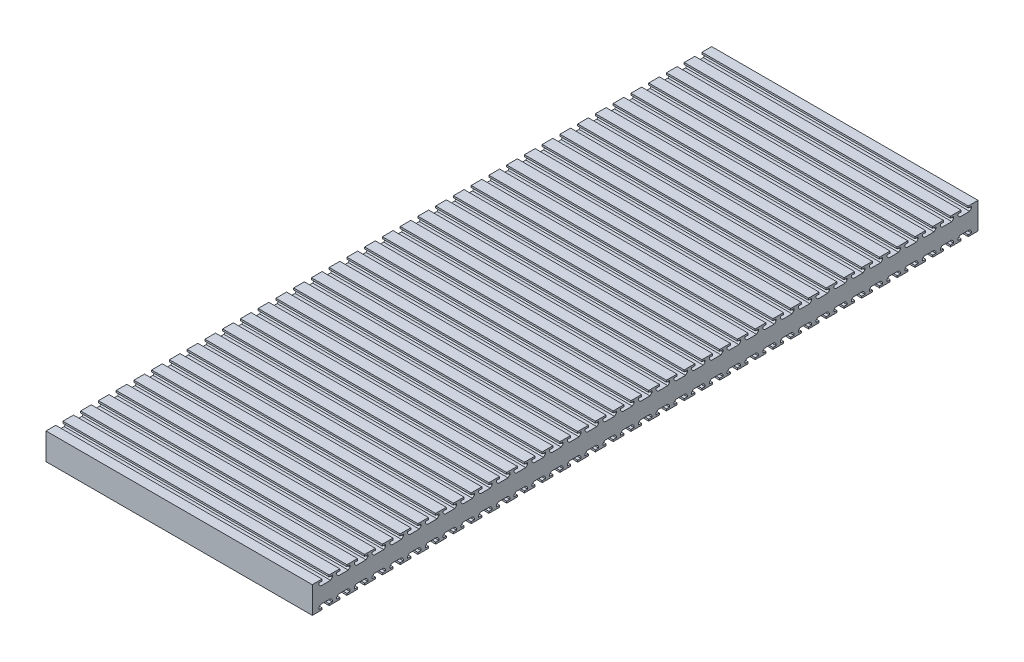
from build123d import *

# Parameters (mm, degrees)
ESBO_O1_W                = 300
ESBO_O1_H                = 30
RESSALTO_EXTRUS_O1_DEPTH = 375
CORTE_EXTRUS_O1_DEPTH    = 481.468521341
PADR_O_LINEAR1_COUNT     = 37
PADR_O_LINEAR1_PITCH     = 20
ESPELHAR1_COPY_1_DEPTH   = 481.468521341
ESPELHAR1_COPY_2_DEPTH   = 481.468521341
ESPELHAR1_COPY_3_DEPTH   = 481.468521341
ESPELHAR1_COPY_4_DEPTH   = 481.468521341
ESPELHAR1_COPY_5_DEPTH   = 481.468521341
ESPELHAR1_COPY_6_DEPTH   = 481.468521341
ESPELHAR1_COPY_7_DEPTH   = 481.468521341
ESPELHAR1_COPY_8_DEPTH   = 481.468521341
ESPELHAR1_COPY_9_DEPTH   = 481.468521341
ESPELHAR1_COPY_10_DEPTH  = 481.468521341
ESPELHAR1_COPY_11_DEPTH  = 481.468521341
ESPELHAR1_COPY_12_DEPTH  = 481.468521341
ESPELHAR1_COPY_13_DEPTH  = 481.468521341
ESPELHAR1_COPY_14_DEPTH  = 481.468521341
ESPELHAR1_COPY_15_DEPTH  = 481.468521341
ESPELHAR1_COPY_16_DEPTH  = 481.468521341
ESPELHAR1_COPY_17_DEPTH  = 481.468521341
ESPELHAR1_COPY_18_DEPTH  = 481.468521341
ESPELHAR1_COPY_19_DEPTH  = 481.468521341
ESPELHAR1_COPY_20_DEPTH  = 481.468521341
ESPELHAR1_COPY_21_DEPTH  = 481.468521341
ESPELHAR1_COPY_22_DEPTH  = 481.468521341
ESPELHAR1_COPY_23_DEPTH  = 481.468521341
ESPELHAR1_COPY_24_DEPTH  = 481.468521341
ESPELHAR1_COPY_25_DEPTH  = 481.468521341
ESPELHAR1_COPY_26_DEPTH  = 481.468521341
ESPELHAR1_COPY_27_DEPTH  = 481.468521341
ESPELHAR1_COPY_28_DEPTH  = 481.468521341
ESPELHAR1_COPY_29_DEPTH  = 481.468521341
ESPELHAR1_COPY_30_DEPTH  = 481.468521341
ESPELHAR1_COPY_31_DEPTH  = 481.468521341
ESPELHAR1_COPY_32_DEPTH  = 481.468521341
ESPELHAR1_COPY_33_DEPTH  = 481.468521341
ESPELHAR1_COPY_34_DEPTH  = 481.468521341
ESPELHAR1_COPY_35_DEPTH  = 481.468521341
ESPELHAR1_COPY_36_DEPTH  = 481.468521341
ESPELHAR1_COPY_37_DEPTH  = 481.468521341


with BuildPart() as part:
    # Esboço1 → Ressalto-extrusão1 (new, symmetric)
    with BuildSketch(Plane.XY):
        Rectangle(ESBO_O1_W, ESBO_O1_H)
    extrude(amount=RESSALTO_EXTRUS_O1_DEPTH, both=True)

    # Esboço2 → Corte-extrusão1 (cut, through all)
    with BuildSketch(Plane(origin=(150, 0, 0), x_dir=(0, 0, -1), z_dir=(1, 0, 0))):
        Polygon((-364, 15), (-364, 13), (-367.5, 13), (-367.5, 11), (-365.5, 9), (-354.5, 9), (-352.5, 11), (-352.5, 13), (-356, 13), (-356, 15), align=None)
    corte_extrus_o1 = extrude(amount=-CORTE_EXTRUS_O1_DEPTH, mode=Mode.SUBTRACT)

    # Padrão linear1: Corte-extrusão1 ×37
    with Locations(*[(0, 0, -i * PADR_O_LINEAR1_PITCH) for i in range(1, PADR_O_LINEAR1_COUNT)]):
        add(corte_extrus_o1, mode=Mode.SUBTRACT)

    # Espelhar1 copy 1 sketch → Espelhar1 copy 1 (cut, through all)
    with BuildSketch(Plane(origin=(150, 0, -20), x_dir=(0, 0, -1), z_dir=(1, 0, 0))):
        Polygon((-364, -15), (-364, -13), (-367.5, -13), (-367.5, -11), (-365.5, -9), (-354.5, -9), (-352.5, -11), (-352.5, -13), (-356, -13), (-356, -15), align=None)
    extrude(amount=-ESPELHAR1_COPY_1_DEPTH, mode=Mode.SUBTRACT)

    # Espelhar1 copy 2 sketch → Espelhar1 copy 2 (cut, through all)
    with BuildSketch(Plane(origin=(150, 0, -40), x_dir=(0, 0, -1), z_dir=(1, 0, 0))):
        Polygon((-364, -15), (-364, -13), (-367.5, -13), (-367.5, -11), (-365.5, -9), (-354.5, -9), (-352.5, -11), (-352.5, -13), (-356, -13), (-356, -15), align=None)
    extrude(amount=-ESPELHAR1_COPY_2_DEPTH, mode=Mode.SUBTRACT)

    # Espelhar1 copy 3 sketch → Espelhar1 copy 3 (cut, through all)
    with BuildSketch(Plane(origin=(150, 0, -60), x_dir=(0, 0, -1), z_dir=(1, 0, 0))):
        Polygon((-364, -15), (-364, -13), (-367.5, -13), (-367.5, -11), (-365.5, -9), (-354.5, -9), (-352.5, -11), (-352.5, -13), (-356, -13), (-356, -15), align=None)
    extrude(amount=-ESPELHAR1_COPY_3_DEPTH, mode=Mode.SUBTRACT)

    # Espelhar1 copy 4 sketch → Espelhar1 copy 4 (cut, through all)
    with BuildSketch(Plane(origin=(150, 0, -80), x_dir=(0, 0, -1), z_dir=(1, 0, 0))):
        Polygon((-364, -15), (-364, -13), (-367.5, -13), (-367.5, -11), (-365.5, -9), (-354.5, -9), (-352.5, -11), (-352.5, -13), (-356, -13), (-356, -15), align=None)
    extrude(amount=-ESPELHAR1_COPY_4_DEPTH, mode=Mode.SUBTRACT)

    # Espelhar1 copy 5 sketch → Espelhar1 copy 5 (cut, through all)
    with BuildSketch(Plane(origin=(150, 0, -100), x_dir=(0, 0, -1), z_dir=(1, 0, 0))):
        Polygon((-364, -15), (-364, -13), (-367.5, -13), (-367.5, -11), (-365.5, -9), (-354.5, -9), (-352.5, -11), (-352.5, -13), (-356, -13), (-356, -15), align=None)
    extrude(amount=-ESPELHAR1_COPY_5_DEPTH, mode=Mode.SUBTRACT)

    # Espelhar1 copy 6 sketch → Espelhar1 copy 6 (cut, through all)
    with BuildSketch(Plane(origin=(150, 0, -120), x_dir=(0, 0, -1), z_dir=(1, 0, 0))):
        Polygon((-364, -15), (-364, -13), (-367.5, -13), (-367.5, -11), (-365.5, -9), (-354.5, -9), (-352.5, -11), (-352.5, -13), (-356, -13), (-356, -15), align=None)
    extrude(amount=-ESPELHAR1_COPY_6_DEPTH, mode=Mode.SUBTRACT)

    # Espelhar1 copy 7 sketch → Espelhar1 copy 7 (cut, through all)
    with BuildSketch(Plane(origin=(150, 0, -140), x_dir=(0, 0, -1), z_dir=(1, 0, 0))):
        Polygon((-364, -15), (-364, -13), (-367.5, -13), (-367.5, -11), (-365.5, -9), (-354.5, -9), (-352.5, -11), (-352.5, -13), (-356, -13), (-356, -15), align=None)
    extrude(amount=-ESPELHAR1_COPY_7_DEPTH, mode=Mode.SUBTRACT)

    # Espelhar1 copy 8 sketch → Espelhar1 copy 8 (cut, through all)
    with BuildSketch(Plane(origin=(150, 0, -160), x_dir=(0, 0, -1), z_dir=(1, 0, 0))):
        Polygon((-364, -15), (-364, -13), (-367.5, -13), (-367.5, -11), (-365.5, -9), (-354.5, -9), (-352.5, -11), (-352.5, -13), (-356, -13), (-356, -15), align=None)
    extrude(amount=-ESPELHAR1_COPY_8_DEPTH, mode=Mode.SUBTRACT)

    # Espelhar1 copy 9 sketch → Espelhar1 copy 9 (cut, through all)
    with BuildSketch(Plane(origin=(150, 0, -180), x_dir=(0, 0, -1), z_dir=(1, 0, 0))):
        Polygon((-364, -15), (-364, -13), (-367.5, -13), (-367.5, -11), (-365.5, -9), (-354.5, -9), (-352.5, -11), (-352.5, -13), (-356, -13), (-356, -15), align=None)
    extrude(amount=-ESPELHAR1_COPY_9_DEPTH, mode=Mode.SUBTRACT)

    # Espelhar1 copy 10 sketch → Espelhar1 copy 10 (cut, through all)
    with BuildSketch(Plane(origin=(150, 0, -200), x_dir=(0, 0, -1), z_dir=(1, 0, 0))):
        Polygon((-364, -15), (-364, -13), (-367.5, -13), (-367.5, -11), (-365.5, -9), (-354.5, -9), (-352.5, -11), (-352.5, -13), (-356, -13), (-356, -15), align=None)
    extrude(amount=-ESPELHAR1_COPY_10_DEPTH, mode=Mode.SUBTRACT)

    # Espelhar1 copy 11 sketch → Espelhar1 copy 11 (cut, through all)
    with BuildSketch(Plane(origin=(150, 0, -220), x_dir=(0, 0, -1), z_dir=(1, 0, 0))):
        Polygon((-364, -15), (-364, -13), (-367.5, -13), (-367.5, -11), (-365.5, -9), (-354.5, -9), (-352.5, -11), (-352.5, -13), (-356, -13), (-356, -15), align=None)
    extrude(amount=-ESPELHAR1_COPY_11_DEPTH, mode=Mode.SUBTRACT)

    # Espelhar1 copy 12 sketch → Espelhar1 copy 12 (cut, through all)
    with BuildSketch(Plane(origin=(150, 0, -240), x_dir=(0, 0, -1), z_dir=(1, 0, 0))):
        Polygon((-364, -15), (-364, -13), (-367.5, -13), (-367.5, -11), (-365.5, -9), (-354.5, -9), (-352.5, -11), (-352.5, -13), (-356, -13), (-356, -15), align=None)
    extrude(amount=-ESPELHAR1_COPY_12_DEPTH, mode=Mode.SUBTRACT)

    # Espelhar1 copy 13 sketch → Espelhar1 copy 13 (cut, through all)
    with BuildSketch(Plane(origin=(150, 0, -260), x_dir=(0, 0, -1), z_dir=(1, 0, 0))):
        Polygon((-364, -15), (-364, -13), (-367.5, -13), (-367.5, -11), (-365.5, -9), (-354.5, -9), (-352.5, -11), (-352.5, -13), (-356, -13), (-356, -15), align=None)
    extrude(amount=-ESPELHAR1_COPY_13_DEPTH, mode=Mode.SUBTRACT)

    # Espelhar1 copy 14 sketch → Espelhar1 copy 14 (cut, through all)
    with BuildSketch(Plane(origin=(150, 0, -280), x_dir=(0, 0, -1), z_dir=(1, 0, 0))):
        Polygon((-364, -15), (-364, -13), (-367.5, -13), (-367.5, -11), (-365.5, -9), (-354.5, -9), (-352.5, -11), (-352.5, -13), (-356, -13), (-356, -15), align=None)
    extrude(amount=-ESPELHAR1_COPY_14_DEPTH, mode=Mode.SUBTRACT)

    # Espelhar1 copy 15 sketch → Espelhar1 copy 15 (cut, through all)
    with BuildSketch(Plane(origin=(150, 0, -300), x_dir=(0, 0, -1), z_dir=(1, 0, 0))):
        Polygon((-364, -15), (-364, -13), (-367.5, -13), (-367.5, -11), (-365.5, -9), (-354.5, -9), (-352.5, -11), (-352.5, -13), (-356, -13), (-356, -15), align=None)
    extrude(amount=-ESPELHAR1_COPY_15_DEPTH, mode=Mode.SUBTRACT)

    # Espelhar1 copy 16 sketch → Espelhar1 copy 16 (cut, through all)
    with BuildSketch(Plane(origin=(150, 0, -320), x_dir=(0, 0, -1), z_dir=(1, 0, 0))):
        Polygon((-364, -15), (-364, -13), (-367.5, -13), (-367.5, -11), (-365.5, -9), (-354.5, -9), (-352.5, -11), (-352.5, -13), (-356, -13), (-356, -15), align=None)
    extrude(amount=-ESPELHAR1_COPY_16_DEPTH, mode=Mode.SUBTRACT)

    # Espelhar1 copy 17 sketch → Espelhar1 copy 17 (cut, through all)
    with BuildSketch(Plane(origin=(150, 0, -340), x_dir=(0, 0, -1), z_dir=(1, 0, 0))):
        Polygon((-364, -15), (-364, -13), (-367.5, -13), (-367.5, -11), (-365.5, -9), (-354.5, -9), (-352.5, -11), (-352.5, -13), (-356, -13), (-356, -15), align=None)
    extrude(amount=-ESPELHAR1_COPY_17_DEPTH, mode=Mode.SUBTRACT)

    # Espelhar1 copy 18 sketch → Espelhar1 copy 18 (cut, through all)
    with BuildSketch(Plane(origin=(150, 0, -360), x_dir=(0, 0, -1), z_dir=(1, 0, 0))):
        Polygon((-364, -15), (-364, -13), (-367.5, -13), (-367.5, -11), (-365.5, -9), (-354.5, -9), (-352.5, -11), (-352.5, -13), (-356, -13), (-356, -15), align=None)
    extrude(amount=-ESPELHAR1_COPY_18_DEPTH, mode=Mode.SUBTRACT)

    # Espelhar1 copy 19 sketch → Espelhar1 copy 19 (cut, through all)
    with BuildSketch(Plane(origin=(150, 0, -380), x_dir=(0, 0, -1), z_dir=(1, 0, 0))):
        Polygon((-364, -15), (-364, -13), (-367.5, -13), (-367.5, -11), (-365.5, -9), (-354.5, -9), (-352.5, -11), (-352.5, -13), (-356, -13), (-356, -15), align=None)
    extrude(amount=-ESPELHAR1_COPY_19_DEPTH, mode=Mode.SUBTRACT)

    # Espelhar1 copy 20 sketch → Espelhar1 copy 20 (cut, through all)
    with BuildSketch(Plane(origin=(150, 0, -400), x_dir=(0, 0, -1), z_dir=(1, 0, 0))):
        Polygon((-364, -15), (-364, -13), (-367.5, -13), (-367.5, -11), (-365.5, -9), (-354.5, -9), (-352.5, -11), (-352.5, -13), (-356, -13), (-356, -15), align=None)
    extrude(amount=-ESPELHAR1_COPY_20_DEPTH, mode=Mode.SUBTRACT)

    # Espelhar1 copy 21 sketch → Espelhar1 copy 21 (cut, through all)
    with BuildSketch(Plane(origin=(150, 0, -420), x_dir=(0, 0, -1), z_dir=(1, 0, 0))):
        Polygon((-364, -15), (-364, -13), (-367.5, -13), (-367.5, -11), (-365.5, -9), (-354.5, -9), (-352.5, -11), (-352.5, -13), (-356, -13), (-356, -15), align=None)
    extrude(amount=-ESPELHAR1_COPY_21_DEPTH, mode=Mode.SUBTRACT)

    # Espelhar1 copy 22 sketch → Espelhar1 copy 22 (cut, through all)
    with BuildSketch(Plane(origin=(150, 0, -440), x_dir=(0, 0, -1), z_dir=(1, 0, 0))):
        Polygon((-364, -15), (-364, -13), (-367.5, -13), (-367.5, -11), (-365.5, -9), (-354.5, -9), (-352.5, -11), (-352.5, -13), (-356, -13), (-356, -15), align=None)
    extrude(amount=-ESPELHAR1_COPY_22_DEPTH, mode=Mode.SUBTRACT)

    # Espelhar1 copy 23 sketch → Espelhar1 copy 23 (cut, through all)
    with BuildSketch(Plane(origin=(150, 0, -460), x_dir=(0, 0, -1), z_dir=(1, 0, 0))):
        Polygon((-364, -15), (-364, -13), (-367.5, -13), (-367.5, -11), (-365.5, -9), (-354.5, -9), (-352.5, -11), (-352.5, -13), (-356, -13), (-356, -15), align=None)
    extrude(amount=-ESPELHAR1_COPY_23_DEPTH, mode=Mode.SUBTRACT)

    # Espelhar1 copy 24 sketch → Espelhar1 copy 24 (cut, through all)
    with BuildSketch(Plane(origin=(150, 0, -480), x_dir=(0, 0, -1), z_dir=(1, 0, 0))):
        Polygon((-364, -15), (-364, -13), (-367.5, -13), (-367.5, -11), (-365.5, -9), (-354.5, -9), (-352.5, -11), (-352.5, -13), (-356, -13), (-356, -15), align=None)
    extrude(amount=-ESPELHAR1_COPY_24_DEPTH, mode=Mode.SUBTRACT)

    # Espelhar1 copy 25 sketch → Espelhar1 copy 25 (cut, through all)
    with BuildSketch(Plane(origin=(150, 0, -500), x_dir=(0, 0, -1), z_dir=(1, 0, 0))):
        Polygon((-364, -15), (-364, -13), (-367.5, -13), (-367.5, -11), (-365.5, -9), (-354.5, -9), (-352.5, -11), (-352.5, -13), (-356, -13), (-356, -15), align=None)
    extrude(amount=-ESPELHAR1_COPY_25_DEPTH, mode=Mode.SUBTRACT)

    # Espelhar1 copy 26 sketch → Espelhar1 copy 26 (cut, through all)
    with BuildSketch(Plane(origin=(150, 0, -520), x_dir=(0, 0, -1), z_dir=(1, 0, 0))):
        Polygon((-364, -15), (-364, -13), (-367.5, -13), (-367.5, -11), (-365.5, -9), (-354.5, -9), (-352.5, -11), (-352.5, -13), (-356, -13), (-356, -15), align=None)
    extrude(amount=-ESPELHAR1_COPY_26_DEPTH, mode=Mode.SUBTRACT)

    # Espelhar1 copy 27 sketch → Espelhar1 copy 27 (cut, through all)
    with BuildSketch(Plane(origin=(150, 0, -540), x_dir=(0, 0, -1), z_dir=(1, 0, 0))):
        Polygon((-364, -15), (-364, -13), (-367.5, -13), (-367.5, -11), (-365.5, -9), (-354.5, -9), (-352.5, -11), (-352.5, -13), (-356, -13), (-356, -15), align=None)
    extrude(amount=-ESPELHAR1_COPY_27_DEPTH, mode=Mode.SUBTRACT)

    # Espelhar1 copy 28 sketch → Espelhar1 copy 28 (cut, through all)
    with BuildSketch(Plane(origin=(150, 0, -560), x_dir=(0, 0, -1), z_dir=(1, 0, 0))):
        Polygon((-364, -15), (-364, -13), (-367.5, -13), (-367.5, -11), (-365.5, -9), (-354.5, -9), (-352.5, -11), (-352.5, -13), (-356, -13), (-356, -15), align=None)
    extrude(amount=-ESPELHAR1_COPY_28_DEPTH, mode=Mode.SUBTRACT)

    # Espelhar1 copy 29 sketch → Espelhar1 copy 29 (cut, through all)
    with BuildSketch(Plane(origin=(150, 0, -580), x_dir=(0, 0, -1), z_dir=(1, 0, 0))):
        Polygon((-364, -15), (-364, -13), (-367.5, -13), (-367.5, -11), (-365.5, -9), (-354.5, -9), (-352.5, -11), (-352.5, -13), (-356, -13), (-356, -15), align=None)
    extrude(amount=-ESPELHAR1_COPY_29_DEPTH, mode=Mode.SUBTRACT)

    # Espelhar1 copy 30 sketch → Espelhar1 copy 30 (cut, through all)
    with BuildSketch(Plane(origin=(150, 0, -600), x_dir=(0, 0, -1), z_dir=(1, 0, 0))):
        Polygon((-364, -15), (-364, -13), (-367.5, -13), (-367.5, -11), (-365.5, -9), (-354.5, -9), (-352.5, -11), (-352.5, -13), (-356, -13), (-356, -15), align=None)
    extrude(amount=-ESPELHAR1_COPY_30_DEPTH, mode=Mode.SUBTRACT)

    # Espelhar1 copy 31 sketch → Espelhar1 copy 31 (cut, through all)
    with BuildSketch(Plane(origin=(150, 0, -620), x_dir=(0, 0, -1), z_dir=(1, 0, 0))):
        Polygon((-364, -15), (-364, -13), (-367.5, -13), (-367.5, -11), (-365.5, -9), (-354.5, -9), (-352.5, -11), (-352.5, -13), (-356, -13), (-356, -15), align=None)
    extrude(amount=-ESPELHAR1_COPY_31_DEPTH, mode=Mode.SUBTRACT)

    # Espelhar1 copy 32 sketch → Espelhar1 copy 32 (cut, through all)
    with BuildSketch(Plane(origin=(150, 0, -640), x_dir=(0, 0, -1), z_dir=(1, 0, 0))):
        Polygon((-364, -15), (-364, -13), (-367.5, -13), (-367.5, -11), (-365.5, -9), (-354.5, -9), (-352.5, -11), (-352.5, -13), (-356, -13), (-356, -15), align=None)
    extrude(amount=-ESPELHAR1_COPY_32_DEPTH, mode=Mode.SUBTRACT)

    # Espelhar1 copy 33 sketch → Espelhar1 copy 33 (cut, through all)
    with BuildSketch(Plane(origin=(150, 0, -660), x_dir=(0, 0, -1), z_dir=(1, 0, 0))):
        Polygon((-364, -15), (-364, -13), (-367.5, -13), (-367.5, -11), (-365.5, -9), (-354.5, -9), (-352.5, -11), (-352.5, -13), (-356, -13), (-356, -15), align=None)
    extrude(amount=-ESPELHAR1_COPY_33_DEPTH, mode=Mode.SUBTRACT)

    # Espelhar1 copy 34 sketch → Espelhar1 copy 34 (cut, through all)
    with BuildSketch(Plane(origin=(150, 0, -680), x_dir=(0, 0, -1), z_dir=(1, 0, 0))):
        Polygon((-364, -15), (-364, -13), (-367.5, -13), (-367.5, -11), (-365.5, -9), (-354.5, -9), (-352.5, -11), (-352.5, -13), (-356, -13), (-356, -15), align=None)
    extrude(amount=-ESPELHAR1_COPY_34_DEPTH, mode=Mode.SUBTRACT)

    # Espelhar1 copy 35 sketch → Espelhar1 copy 35 (cut, through all)
    with BuildSketch(Plane(origin=(150, 0, -700), x_dir=(0, 0, -1), z_dir=(1, 0, 0))):
        Polygon((-364, -15), (-364, -13), (-367.5, -13), (-367.5, -11), (-365.5, -9), (-354.5, -9), (-352.5, -11), (-352.5, -13), (-356, -13), (-356, -15), align=None)
    extrude(amount=-ESPELHAR1_COPY_35_DEPTH, mode=Mode.SUBTRACT)

    # Espelhar1 copy 36 sketch → Espelhar1 copy 36 (cut, through all)
    with BuildSketch(Plane(origin=(150, 0, -720), x_dir=(0, 0, -1), z_dir=(1, 0, 0))):
        Polygon((-364, -15), (-364, -13), (-367.5, -13), (-367.5, -11), (-365.5, -9), (-354.5, -9), (-352.5, -11), (-352.5, -13), (-356, -13), (-356, -15), align=None)
    extrude(amount=-ESPELHAR1_COPY_36_DEPTH, mode=Mode.SUBTRACT)

    # Espelhar1 copy 37 sketch → Espelhar1 copy 37 (cut, through all)
    with BuildSketch(Plane(origin=(150, 0, 0), x_dir=(0, 0, -1), z_dir=(1, 0, 0))):
        Polygon((-364, -15), (-364, -13), (-367.5, -13), (-367.5, -11), (-365.5, -9), (-354.5, -9), (-352.5, -11), (-352.5, -13), (-356, -13), (-356, -15), align=None)
    extrude(amount=-ESPELHAR1_COPY_37_DEPTH, mode=Mode.SUBTRACT)


solid = part.part
